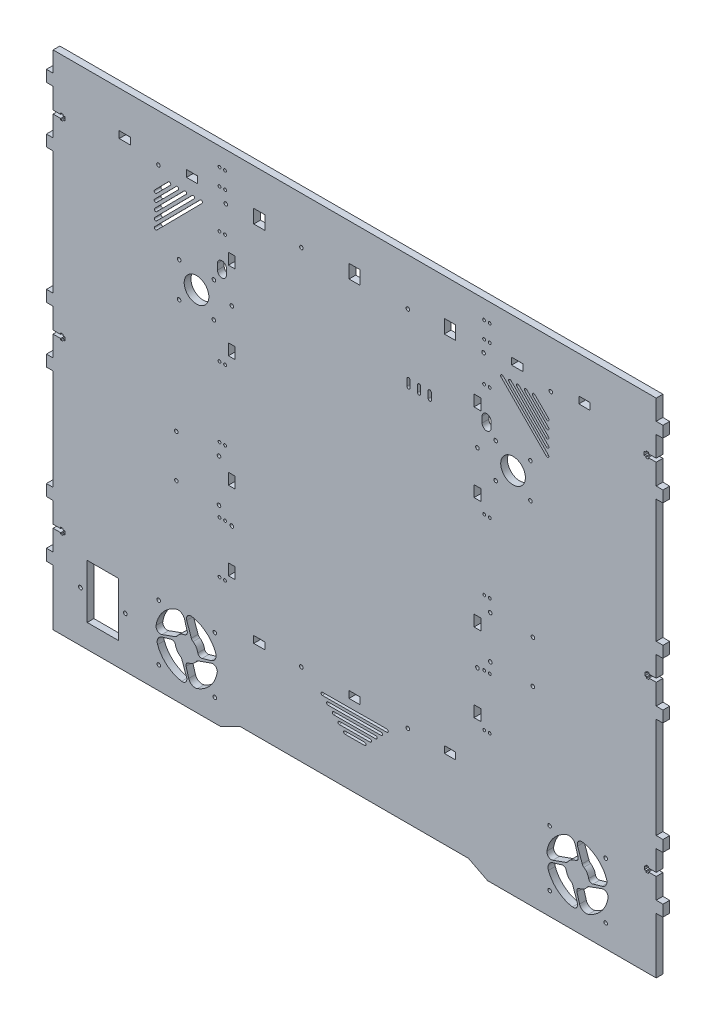
from build123d import *

# Parameters (mm, degrees)
SKETCH_1_R      = 1.6
SKETCH_1_R_2    = 1.65
SKETCH_1_R_3    = 1.25
SKETCH_1_R_4    = 11
SKETCH_1_W      = 10
SKETCH_1_H      = 12.1
SKETCH_1_H_2    = 6.1
SKETCH_1_W_2    = 28.000005
SKETCH_1_H_3    = 48
SKETCH_1_W_3    = 6.1
SKETCH_1_H_4    = 10
EXTRUDE_1_DEPTH = 6


with BuildPart() as part:
    # Эскиз1 → Бобышка-Вытянуть1 (new body)
    with BuildSketch(Plane.XY):
        Polygon((1048.755445299, 42.00723902), (1198.275289364, 42.00723902), (1215.275289364, 50.70723902), (1419.275289364, 50.70723902), (1436.275289364, 42.00723902), (1586.755445299, 42.00723902), (1586.755445299, 42.681206234), (1586.755445299, 91.90723902), (1592.755445299, 92.00723902), (1592.755445299, 102.00723902), (1586.755445299, 102.10723902), (1586.755445299, 120.45723902), (1579.955445299, 120.45723902), (1579.955445299, 119.25723902), (1577.755445299, 119.25723902), (1577.755445299, 120.45723902), (1576.255445299, 120.45723902), (1576.255445299, 123.55723902), (1577.755445299, 123.55723902), (1577.755445299, 124.75723902), (1579.955445299, 124.75723902), (1579.955445299, 123.55723902), (1586.755445299, 123.55723902), (1586.755445299, 141.90723902), (1592.755445299, 142.00723902), (1592.755445299, 152.00723902), (1586.755445299, 152.10723902), (1586.755445299, 241.90723902), (1592.755445299, 242.00723902), (1592.755445299, 252.00723902), (1586.755445299, 252.10723902), (1586.755445299, 270.45723902), (1580.435601234, 270.45723902), (1580.435601234, 269.25723902), (1578.235601234, 269.25723902), (1578.235601234, 270.45723902), (1576.735601234, 270.45723902), (1576.735601234, 273.55723902), (1578.235601234, 273.55723902), (1578.235601234, 274.75723902), (1580.435601234, 274.75723902), (1580.435601234, 273.55723902), (1586.755445299, 273.55723902), (1586.755445299, 291.90723902), (1592.755445298, 292.00723902), (1592.755445298, 302.00723902), (1586.755445298, 302.10723902), (1586.755445298, 411.90723902), (1592.755445297, 412.00723902), (1592.755445297, 422.00723902), (1586.755445299, 422.10723902), (1586.755445299, 440.461521146), (1586.498517724, 440.461521146), (1579.698517724, 440.461521146), (1579.698517724, 439.261521146), (1577.498517724, 439.261521146), (1577.498517724, 440.461521146), (1575.998517724, 440.461521146), (1575.998517724, 443.561521146), (1577.498517724, 443.561521146), (1577.498517724, 444.761521146), (1579.698517724, 444.761521146), (1579.698517724, 443.561521146), (1586.498517724, 443.561521146), (1586.755445299, 443.561521146), (1586.755445299, 461.915803272), (1592.755445296, 462.015803272), (1592.755445296, 472.00723902), (1586.755445299, 472.10723902), (1586.755445299, 490.00723902), (1586.01836179, 490.00723902), (1048.755445299, 490.00723902), (1048.755445299, 477.00723902), (1048.755445299, 472.10723902), (1042.755445299, 472.00723902), (1042.755445299, 462.00723902), (1048.755445299, 461.90723902), (1048.755445299, 443.55723902), (1055.555445299, 443.55723902), (1055.555445299, 444.75723902), (1057.755445299, 444.75723902), (1057.755445299, 443.55723902), (1059.255445299, 443.55723902), (1059.255445299, 440.45723902), (1057.755445299, 440.45723902), (1057.755445299, 439.25723902), (1055.555445299, 439.25723902), (1055.555445299, 440.45723902), (1048.755445299, 440.45723902), (1048.755445299, 422.10723902), (1042.755445299, 422.00723902), (1042.755445299, 412.00723902), (1048.755445299, 411.90723902), (1048.755445299, 302.10723902), (1042.755445299, 302.00723902), (1042.755445299, 292.00723902), (1048.755445299, 291.90723902), (1048.755445299, 273.55723902), (1055.555445299, 273.55723902), (1055.555445299, 274.75723902), (1057.755445299, 274.75723902), (1057.755445299, 273.55723902), (1059.255445299, 273.55723902), (1059.255445299, 270.45723902), (1057.755445299, 270.45723902), (1057.755445299, 269.25723902), (1055.555445299, 269.25723902), (1055.555445299, 270.45723902), (1048.755445299, 270.45723902), (1048.755445299, 252.10723902), (1042.755445299, 252.00723902), (1042.755445299, 242.00723902), (1048.755445299, 241.90723902), (1048.755445299, 152.10723902), (1042.755445299, 152.00723902), (1042.755445299, 142.00723902), (1048.755445299, 141.90723902), (1048.755445299, 123.55723902), (1055.555445299, 123.55723902), (1055.555445299, 124.75723902), (1057.755445299, 124.75723902), (1057.755445299, 123.55723902), (1059.255445299, 123.55723902), (1059.255445299, 120.45723902), (1057.755445299, 120.45723902), (1057.755445299, 119.25723902), (1055.555445299, 119.25723902), (1055.555445299, 120.45723902), (1048.755445299, 120.45723902), (1048.755445299, 102.10723902), (1042.755445299, 102.00723902), (1042.755445299, 92.00723902), (1048.755445299, 91.90723902), (1048.755445299, 42.676924107), align=None)
        with Locations((1202.755445299, 448.05723902)):
            Circle(SKETCH_1_R, mode=Mode.SUBTRACT)
        with Locations((1432.755445299, 448.05723902)):
            Circle(SKETCH_1_R, mode=Mode.SUBTRACT)
        with Locations((1365.255445299, 448.05723902)):
            Circle(SKETCH_1_R, mode=Mode.SUBTRACT)
        with Locations((1270.255445299, 448.05723902)):
            Circle(SKETCH_1_R, mode=Mode.SUBTRACT)
        with Locations((1365.255445299, 124.05491402)):
            Circle(SKETCH_1_R, mode=Mode.SUBTRACT)
        with Locations((1270.255445299, 124.05491402)):
            Circle(SKETCH_1_R, mode=Mode.SUBTRACT)
        with Locations((1492.755445299, 448.05723902)):
            Circle(SKETCH_1_R, mode=Mode.SUBTRACT)
        with Locations((1142.755445299, 448.05723902)):
            Circle(SKETCH_1_R, mode=Mode.SUBTRACT)
        with Locations((1073.162844871, 86.87758802)):
            Circle(SKETCH_1_R_2, mode=Mode.SUBTRACT)
        with Locations((1113.162844871, 86.87758802)):
            Circle(SKETCH_1_R_2, mode=Mode.SUBTRACT)
        with Locations((1143.031783229, 112.012971893)):
            Circle(SKETCH_1_R, mode=Mode.SUBTRACT)
        with Locations((1143.031783229, 62.012971893)):
            Circle(SKETCH_1_R, mode=Mode.SUBTRACT)
        with Locations((1541.689341871, 112.012971893)):
            Circle(SKETCH_1_R, mode=Mode.SUBTRACT)
        with Locations((1541.689341871, 62.012971893)):
            Circle(SKETCH_1_R, mode=Mode.SUBTRACT)
        with Locations((1491.689341871, 112.012971893)):
            Circle(SKETCH_1_R, mode=Mode.SUBTRACT)
        with Locations((1491.689341871, 62.012971893)):
            Circle(SKETCH_1_R, mode=Mode.SUBTRACT)
        with Locations((1193.031783229, 62.012971893)):
            Circle(SKETCH_1_R, mode=Mode.SUBTRACT)
        with Locations((1193.031783229, 112.012971893)):
            Circle(SKETCH_1_R, mode=Mode.SUBTRACT)
        with Locations((1427.305445299, 371.90723902)):
            Circle(SKETCH_1_R, mode=Mode.SUBTRACT)
        with Locations((1427.305445299, 201.90723902)):
            Circle(SKETCH_1_R, mode=Mode.SUBTRACT)
        with Locations((1208.205445299, 201.90723902)):
            Circle(SKETCH_1_R, mode=Mode.SUBTRACT)
        with Locations((1208.205445299, 371.90723902)):
            Circle(SKETCH_1_R, mode=Mode.SUBTRACT)
        with Locations((1202.195892293, 261.19163302)):
            Circle(SKETCH_1_R_3, mode=Mode.SUBTRACT)
        with Locations((1197.224537293, 261.25949102)):
            Circle(SKETCH_1_R_3, mode=Mode.SUBTRACT)
        with Locations((1196.754056699, 250.273882543)):
            Circle(SKETCH_1_R, mode=Mode.SUBTRACT)
        with Locations((1158.754056699, 250.273882543)):
            Circle(SKETCH_1_R, mode=Mode.SUBTRACT)
        with Locations((1158.754056699, 212.273882543)):
            Circle(SKETCH_1_R, mode=Mode.SUBTRACT)
        with Locations((1196.754056699, 212.273882543)):
            Circle(SKETCH_1_R, mode=Mode.SUBTRACT)
        with Locations((1202.160373293, 202.97489902)):
            Circle(SKETCH_1_R_3, mode=Mode.SUBTRACT)
        with Locations((1197.189018293, 203.04275802)):
            Circle(SKETCH_1_R_3, mode=Mode.SUBTRACT)
        with Locations((1202.158586293, 156.83802302)):
            Circle(SKETCH_1_R_3, mode=Mode.SUBTRACT)
        with Locations((1197.187231293, 156.90588202)):
            Circle(SKETCH_1_R_3, mode=Mode.SUBTRACT)
        with Locations((1438.308804299, 156.77016502)):
            Circle(SKETCH_1_R_3, mode=Mode.SUBTRACT)
        with Locations((1433.337449299, 156.83802402)):
            Circle(SKETCH_1_R_3, mode=Mode.SUBTRACT)
        with Locations((1433.339236299, 202.97490002)):
            Circle(SKETCH_1_R_3, mode=Mode.SUBTRACT)
        with Locations((1438.755445299, 212.273882543)):
            Circle(SKETCH_1_R, mode=Mode.SUBTRACT)
        with Locations((1438.310591299, 202.90704102)):
            Circle(SKETCH_1_R_3, mode=Mode.SUBTRACT)
        with Locations((1476.755445299, 212.273882543)):
            Circle(SKETCH_1_R, mode=Mode.SUBTRACT)
        with Locations((1476.755445299, 250.273882543)):
            Circle(SKETCH_1_R, mode=Mode.SUBTRACT)
        with Locations((1438.755445299, 250.273882543)):
            Circle(SKETCH_1_R, mode=Mode.SUBTRACT)
        with Locations((1438.346110299, 261.12377502)):
            Circle(SKETCH_1_R_3, mode=Mode.SUBTRACT)
        with Locations((1433.374755299, 261.19163302)):
            Circle(SKETCH_1_R_3, mode=Mode.SUBTRACT)
        with Locations((1438.326800299, 323.41350502)):
            Circle(SKETCH_1_R_3, mode=Mode.SUBTRACT)
        with Locations((1433.355445299, 323.48136302)):
            Circle(SKETCH_1_R_3, mode=Mode.SUBTRACT)
        with Locations((1443.569940463, 354.63990702)):
            Circle(SKETCH_1_R, mode=Mode.SUBTRACT)
        with Locations((1474.569940463, 354.63990702)):
            Circle(SKETCH_1_R, mode=Mode.SUBTRACT)
        with Locations((1474.569940463, 385.63990702)):
            Circle(SKETCH_1_R, mode=Mode.SUBTRACT)
        with Locations((1443.569940463, 385.63990702)):
            Circle(SKETCH_1_R, mode=Mode.SUBTRACT)
        with Locations((1438.192072034, 423.931096255)):
            Circle(SKETCH_1_R_3, mode=Mode.SUBTRACT)
        with Locations((1433.220717034, 423.998954255)):
            Circle(SKETCH_1_R_3, mode=Mode.SUBTRACT)
        with Locations((1438.208280034, 473.505890092)):
            Circle(SKETCH_1_R_3, mode=Mode.SUBTRACT)
        with Locations((1433.236925034, 473.573748092)):
            Circle(SKETCH_1_R_3, mode=Mode.SUBTRACT)
        with Locations((1438.227591034, 458.60640702)):
            Circle(SKETCH_1_R_3, mode=Mode.SUBTRACT)
        with Locations((1433.256236034, 458.67426502)):
            Circle(SKETCH_1_R_3, mode=Mode.SUBTRACT)
        with Locations((1202.176582293, 323.48136302)):
            Circle(SKETCH_1_R_3, mode=Mode.SUBTRACT)
        with Locations((1197.205227293, 323.54922102)):
            Circle(SKETCH_1_R_3, mode=Mode.SUBTRACT)
        with Locations((1161.210430299, 384.13990702)):
            Circle(SKETCH_1_R, mode=Mode.SUBTRACT)
        with Locations((1161.210430299, 353.13990702)):
            Circle(SKETCH_1_R, mode=Mode.SUBTRACT)
        with Locations((1176.710430299, 368.63990702)):
            Circle(SKETCH_1_R_4, mode=Mode.SUBTRACT)
        with Locations((1192.210430299, 353.13990702)):
            Circle(SKETCH_1_R, mode=Mode.SUBTRACT)
        with Locations((1192.210430299, 384.13990702)):
            Circle(SKETCH_1_R, mode=Mode.SUBTRACT)
        with Locations((1197.167882299, 424.066812255)):
            Circle(SKETCH_1_R_3, mode=Mode.SUBTRACT)
        with Locations((1202.139237299, 423.998954255)):
            Circle(SKETCH_1_R_3, mode=Mode.SUBTRACT)
        with Locations((1202.174756299, 458.67426502)):
            Circle(SKETCH_1_R_3, mode=Mode.SUBTRACT)
        with Locations((1197.203401299, 458.74212302)):
            Circle(SKETCH_1_R_3, mode=Mode.SUBTRACT)
        with Locations((1202.155445299, 473.573748092)):
            Circle(SKETCH_1_R_3, mode=Mode.SUBTRACT)
        with Locations((1197.184090299, 473.641606092)):
            Circle(SKETCH_1_R_3, mode=Mode.SUBTRACT)
        with Locations((1459.069940463, 370.13990702)):
            Circle(SKETCH_1_R_4, mode=Mode.SUBTRACT)
        with Locations((1402.755445299, 451.05723902)):
            Rectangle(SKETCH_1_W, SKETCH_1_H, mode=Mode.SUBTRACT)
        with Locations((1232.755445299, 451.05723902)):
            Rectangle(SKETCH_1_W, SKETCH_1_H, mode=Mode.SUBTRACT)
        with Locations((1317.755445299, 451.05723902)):
            Rectangle(SKETCH_1_W, SKETCH_1_H, mode=Mode.SUBTRACT)
        with Locations((1172.755445299, 454.05723902)):
            Rectangle(SKETCH_1_W, SKETCH_1_H_2, mode=Mode.SUBTRACT)
        with Locations((1462.755445299, 454.05723902)):
            Rectangle(SKETCH_1_W, SKETCH_1_H_2, mode=Mode.SUBTRACT)
        with Locations((1402.755445299, 124.05491402)):
            Rectangle(SKETCH_1_W, SKETCH_1_H_2, mode=Mode.SUBTRACT)
        with Locations((1317.755445299, 124.05491402)):
            Rectangle(SKETCH_1_W, SKETCH_1_H_2, mode=Mode.SUBTRACT)
        with Locations((1232.755445299, 124.05491402)):
            Rectangle(SKETCH_1_W, SKETCH_1_H_2, mode=Mode.SUBTRACT)
        with Locations((1093.162846371, 86.87758802)):
            Rectangle(SKETCH_1_W_2, SKETCH_1_H_3, mode=Mode.SUBTRACT)
        with BuildLine():
            Line((1455.450001299, 437.03084302), (1488.851497299, 403.25822002))
            ThreePointArc((1488.851497299, 403.25822002), (1490.619237301, 403.248453504), (1490.629003817, 405.016193507))
            Line((1490.629003817, 405.016193507), (1457.22750805, 438.788816271))
            ThreePointArc((1457.22750805, 438.788816271), (1455.459768173, 438.798582895), (1455.450001299, 437.03084302))
        make_face(mode=Mode.SUBTRACT)
        with BuildLine():
            Line((1326.629180083, 91.617684324), (1309.129447611, 91.521000907))
            ThreePointArc((1309.129447611, 91.521000907), (1307.872560358, 92.764075536), (1309.115634987, 94.020962789))
            Line((1309.115634987, 94.020962789), (1326.615368167, 94.1176455))
            ThreePointArc((1326.615368167, 94.1176455), (1327.872254713, 92.87457087), (1326.629180083, 91.617684324))
        make_face(mode=Mode.SUBTRACT)
        with BuildLine():
            Line((1331.601480015, 96.645231923), (1304.101899305, 96.493300132))
            ThreePointArc((1304.101899305, 96.493300132), (1302.845012759, 97.736375468), (1304.088088096, 98.993262014))
            Line((1304.088088096, 98.993262014), (1331.587668099, 99.145193099))
            ThreePointArc((1331.587668099, 99.145193099), (1332.844554645, 97.902118469), (1331.601480015, 96.645231923))
        make_face(mode=Mode.SUBTRACT)
        with BuildLine():
            Line((1336.573779947, 101.672779522), (1299.074351706, 101.465600064))
            ThreePointArc((1299.074351706, 101.465600064), (1297.81746516, 102.7086754), (1299.060540497, 103.965561946))
            Line((1299.060540497, 103.965561946), (1336.559967324, 104.172741405))
            ThreePointArc((1336.559967324, 104.172741405), (1337.816854577, 102.929666775), (1336.573779947, 101.672779522))
        make_face(mode=Mode.SUBTRACT)
        with BuildLine():
            Line((1289.005445299, 113.91016181), (1346.504567188, 114.227836603))
            ThreePointArc((1346.504567188, 114.227836603), (1347.761454441, 112.984761973), (1346.518379811, 111.72787472))
            Line((1346.518379811, 111.72787472), (1289.019256508, 111.410199928))
            ThreePointArc((1289.019256508, 111.410199928), (1287.762369962, 112.653275264), (1289.005445299, 113.91016181))
        make_face(mode=Mode.SUBTRACT)
        with BuildLine():
            Line((1341.546079879, 106.700327121), (1294.046804107, 106.437899996))
            ThreePointArc((1294.046804107, 106.437899996), (1292.789917561, 107.680975332), (1294.032992898, 108.937861878))
            Line((1294.032992898, 108.937861878), (1341.532267256, 109.200289004))
            ThreePointArc((1341.532267256, 109.200289004), (1342.789154509, 107.957214374), (1341.546079879, 106.700327121))
        make_face(mode=Mode.SUBTRACT)
        with BuildLine():
            Line((1448.379042299, 437.06990902), (1488.812431299, 396.18726002))
            ThreePointArc((1488.812431299, 396.18726002), (1490.580171301, 396.177493483), (1490.589937838, 397.945233486))
            Line((1490.589937838, 397.945233486), (1450.156548558, 438.827882757))
            ThreePointArc((1450.156548558, 438.827882757), (1448.38880843, 438.837649149), (1448.379042299, 437.06990902))
        make_face(mode=Mode.SUBTRACT)
        with BuildLine():
            Line((1469.591921299, 436.95271102), (1488.929629299, 417.40013902))
            ThreePointArc((1488.929629299, 417.40013902), (1490.697369798, 417.390372517), (1490.707136301, 419.158113017))
            Line((1490.707136301, 419.158113017), (1471.36942805, 438.710684271))
            ThreePointArc((1471.36942805, 438.710684271), (1469.601688173, 438.720450895), (1469.591921299, 436.95271102))
        make_face(mode=Mode.SUBTRACT)
        with BuildLine():
            Line((1476.662881299, 436.91364502), (1488.968695299, 424.47109902))
            ThreePointArc((1488.968695299, 424.47109902), (1490.736435798, 424.461332517), (1490.746202302, 426.229073017))
            Line((1490.746202302, 426.229073017), (1478.44038805, 438.671618271))
            ThreePointArc((1478.44038805, 438.671618271), (1476.672648173, 438.681384895), (1476.662881299, 436.91364502))
        make_face(mode=Mode.SUBTRACT)
        with BuildLine():
            Line((1462.520961299, 436.99177702), (1488.890563299, 410.32917902))
            ThreePointArc((1488.890563299, 410.32917902), (1490.658303798, 410.319412517), (1490.668070301, 412.087153017))
            Line((1490.668070301, 412.087153017), (1464.29846805, 438.749750271))
            ThreePointArc((1464.29846805, 438.749750271), (1462.530728173, 438.759516895), (1462.520961299, 436.99177702))
        make_face(mode=Mode.SUBTRACT)
        with BuildLine():
            Line((1530.317428095, 86.376861737), (1538.475232454, 88.733710728))
            ThreePointArc((1538.475232454, 88.733710728), (1542.17332586, 91.808427073), (1542.425449513, 96.611156411))
            ThreePointArc((1542.425449513, 96.611156411), (1534.073793622, 108.256420171), (1521.01322148, 114.154197673))
            ThreePointArc((1521.01322148, 114.154197673), (1517.29590567, 112.767766584), (1516.60124357, 108.861608297))
            Line((1516.60124357, 108.861608297), (1520.758003302, 97.218443933))
            ThreePointArc((1520.758003302, 97.218443933), (1521.358855676, 96.119028752), (1522.270346342, 95.259422982))
            ThreePointArc((1522.270346342, 95.259422982), (1525.056734388, 92.412613), (1526.534776336, 88.713467502))
            ThreePointArc((1526.534776336, 88.713467502), (1527.908153618, 86.706675217), (1530.317428095, 86.376861737))
        make_face(mode=Mode.SUBTRACT)
        with BuildLine():
            Line((1494.55707538, 86.909353323), (1506.20023984, 91.066114192))
            ThreePointArc((1506.20023984, 91.066114192), (1507.29965486, 91.666966573), (1508.159260507, 92.578457166))
            ThreePointArc((1508.159260507, 92.578457166), (1511.006070681, 95.364845404), (1514.70521647, 96.842887354))
            ThreePointArc((1514.70521647, 96.842887354), (1516.712008813, 98.216264561), (1517.041822384, 100.625539031))
            Line((1517.041822384, 100.625539031), (1514.684973929, 108.783342647))
            ThreePointArc((1514.684973929, 108.783342647), (1511.610257778, 112.481436135), (1506.807528513, 112.73356004))
            ThreePointArc((1506.807528513, 112.73356004), (1495.162263635, 104.381904059), (1489.264485679, 91.321331066))
            ThreePointArc((1489.264485679, 91.321331066), (1490.650916926, 87.604015185), (1494.55707538, 86.909353323))
        make_face(mode=Mode.SUBTRACT)
        with BuildLine():
            Line((1502.766409655, 87.3542366), (1494.608606517, 84.997388283))
            ThreePointArc((1494.608606517, 84.997388283), (1490.910512973, 81.92267202), (1490.658389213, 77.119942632))
            ThreePointArc((1490.658389213, 77.119942632), (1499.010045139, 65.474678548), (1512.070617536, 59.576900922))
            ThreePointArc((1512.070617536, 59.576900922), (1515.787933469, 60.963332183), (1516.482595285, 64.869490698))
            Line((1516.482595285, 64.869490698), (1512.325834508, 76.512654108))
            ThreePointArc((1512.325834508, 76.512654108), (1511.724982125, 77.612069087), (1510.813491551, 78.471674702))
            ThreePointArc((1510.813491551, 78.471674702), (1508.027103292, 81.318484881), (1506.549061331, 85.017630686))
            ThreePointArc((1506.549061331, 85.017630686), (1505.175684124, 87.024423029), (1502.766409655, 87.3542366))
        make_face(mode=Mode.SUBTRACT)
        with BuildLine():
            Line((1538.537978168, 86.806225385), (1526.894813708, 82.649464517))
            ThreePointArc((1526.894813708, 82.649464517), (1525.795398688, 82.048612136), (1524.935793041, 81.137121543))
            ThreePointArc((1524.935793041, 81.137121543), (1522.088983162, 78.350733496), (1518.389837768, 76.872691482))
            ThreePointArc((1518.389837768, 76.872691482), (1516.383045574, 75.499314225), (1516.053232058, 73.090039843))
            Line((1516.053232058, 73.090039843), (1518.410080468, 64.932236381))
            ThreePointArc((1518.410080468, 64.932236381), (1521.484796731, 61.234142837), (1526.287526119, 60.982019077))
            ThreePointArc((1526.287526119, 60.982019077), (1537.932790281, 69.333675098), (1543.830567869, 82.394247642))
            ThreePointArc((1543.830567869, 82.394247642), (1542.444136622, 86.111563523), (1538.537978168, 86.806225385))
        make_face(mode=Mode.SUBTRACT)
        with BuildLine():
            Line((1181.657669299, 437.90607702), (1141.224280061, 397.023427779))
            ThreePointArc((1141.224280061, 397.023427779), (1139.456540178, 397.013661139), (1139.446773299, 398.78140102))
            Line((1139.446773299, 398.78140102), (1179.8801633, 439.664050021))
            ThreePointArc((1179.8801633, 439.664050021), (1181.6479028, 439.67381652), (1181.657669299, 437.90607702))
        make_face(mode=Mode.SUBTRACT)
        with BuildLine():
            Line((1139.290509299, 427.06524102), (1151.5963233, 439.507786021))
            ThreePointArc((1151.5963233, 439.507786021), (1153.3640628, 439.51755252), (1153.373829299, 437.74981302))
            Line((1153.373829299, 437.74981302), (1141.068015583, 425.307267307))
            ThreePointArc((1141.068015583, 425.307267307), (1139.300275442, 425.297500878), (1139.290509299, 427.06524102))
        make_face(mode=Mode.SUBTRACT)
        with BuildLine():
            Line((1174.586709299, 437.86701102), (1141.185214326, 404.094387048))
            ThreePointArc((1141.185214326, 404.094387048), (1139.417473812, 404.084620506), (1139.407707299, 405.85236102))
            Line((1139.407707299, 405.85236102), (1172.8092033, 439.624984021))
            ThreePointArc((1172.8092033, 439.624984021), (1174.5769428, 439.63475052), (1174.586709299, 437.86701102))
        make_face(mode=Mode.SUBTRACT)
        with BuildLine():
            Line((1139.329575299, 419.99428102), (1158.6672833, 439.546852021))
            ThreePointArc((1158.6672833, 439.546852021), (1160.4350228, 439.55661852), (1160.444789299, 437.78887902))
            Line((1160.444789299, 437.78887902), (1141.10708157, 418.236307294))
            ThreePointArc((1141.10708157, 418.236307294), (1139.339341436, 418.226540884), (1139.329575299, 419.99428102))
        make_face(mode=Mode.SUBTRACT)
        with BuildLine():
            Line((1167.515749299, 437.82794502), (1141.146147564, 411.165347288))
            ThreePointArc((1141.146147564, 411.165347288), (1139.378407433, 411.155580887), (1139.368641299, 412.92332102))
            Line((1139.368641299, 412.92332102), (1165.7382433, 439.585918021))
            ThreePointArc((1165.7382433, 439.585918021), (1167.5059828, 439.59568452), (1167.515749299, 437.82794502))
        make_face(mode=Mode.SUBTRACT)
        with Locations((1522.755445299, 454.05723902)):
            Rectangle(SKETCH_1_W, SKETCH_1_H_2, mode=Mode.SUBTRACT)
        with Locations((1112.755445299, 454.05723902)):
            Rectangle(SKETCH_1_W, SKETCH_1_H_2, mode=Mode.SUBTRACT)
        with BuildLine():
            Line((1167.825036644, 64.869490698), (1163.668275867, 76.512654108))
            ThreePointArc((1163.668275867, 76.512654108), (1163.067423484, 77.612069087), (1162.155932909, 78.471674702))
            ThreePointArc((1162.155932909, 78.471674702), (1159.36954465, 81.318484881), (1157.89150269, 85.017630686))
            ThreePointArc((1157.89150269, 85.017630686), (1156.518125483, 87.024423029), (1154.108851013, 87.3542366))
            Line((1154.108851013, 87.3542366), (1145.951047876, 84.997388283))
            ThreePointArc((1145.951047876, 84.997388283), (1142.252954332, 81.92267202), (1142.000830572, 77.119942632))
            ThreePointArc((1142.000830572, 77.119942632), (1150.352486498, 65.474678548), (1163.413058895, 59.576900922))
            ThreePointArc((1163.413058895, 59.576900922), (1167.130374827, 60.963332183), (1167.825036644, 64.869490698))
        make_face(mode=Mode.SUBTRACT)
        with Locations((1427.305445299, 406.90723902)):
            Rectangle(SKETCH_1_W_3, SKETCH_1_H_4, mode=Mode.SUBTRACT)
        with Locations((1427.305445299, 336.90723902)):
            Rectangle(SKETCH_1_W_3, SKETCH_1_H_4, mode=Mode.SUBTRACT)
        with Locations((1427.305445299, 236.90723902)):
            Rectangle(SKETCH_1_W_3, SKETCH_1_H_4, mode=Mode.SUBTRACT)
        with Locations((1427.305445299, 166.90723902)):
            Rectangle(SKETCH_1_W_3, SKETCH_1_H_4, mode=Mode.SUBTRACT)
        with Locations((1208.205445299, 166.90723902)):
            Rectangle(SKETCH_1_W_3, SKETCH_1_H_4, mode=Mode.SUBTRACT)
        with Locations((1208.205445299, 236.90723902)):
            Rectangle(SKETCH_1_W_3, SKETCH_1_H_4, mode=Mode.SUBTRACT)
        with Locations((1208.205445299, 336.90723902)):
            Rectangle(SKETCH_1_W_3, SKETCH_1_H_4, mode=Mode.SUBTRACT)
        with Locations((1208.205445299, 406.90723902)):
            Rectangle(SKETCH_1_W_3, SKETCH_1_H_4, mode=Mode.SUBTRACT)
        with BuildLine():
            Line((1145.899516738, 86.909353323), (1157.542681199, 91.066114192))
            ThreePointArc((1157.542681199, 91.066114192), (1158.642096219, 91.666966573), (1159.501701866, 92.578457166))
            ThreePointArc((1159.501701866, 92.578457166), (1162.348512039, 95.364845404), (1166.047657828, 96.842887354))
            ThreePointArc((1166.047657828, 96.842887354), (1168.054450172, 98.216264561), (1168.384263743, 100.625539031))
            Line((1168.384263743, 100.625539031), (1166.027415288, 108.783342647))
            ThreePointArc((1166.027415288, 108.783342647), (1162.952699137, 112.481436135), (1158.149969872, 112.73356004))
            ThreePointArc((1158.149969872, 112.73356004), (1146.504704993, 104.381904059), (1140.606927038, 91.321331066))
            ThreePointArc((1140.606927038, 91.321331066), (1141.993358285, 87.604015185), (1145.899516738, 86.909353323))
        make_face(mode=Mode.SUBTRACT)
        with BuildLine():
            Line((1189.880419527, 86.806225385), (1178.237255066, 82.649464517))
            ThreePointArc((1178.237255066, 82.649464517), (1177.137840046, 82.048612136), (1176.2782344, 81.137121543))
            ThreePointArc((1176.2782344, 81.137121543), (1173.43142452, 78.350733496), (1169.732279127, 76.872691482))
            ThreePointArc((1169.732279127, 76.872691482), (1167.725486933, 75.499314225), (1167.395673416, 73.090039843))
            Line((1167.395673416, 73.090039843), (1169.752521827, 64.932236381))
            ThreePointArc((1169.752521827, 64.932236381), (1172.82723809, 61.234142837), (1177.629967478, 60.982019077))
            ThreePointArc((1177.629967478, 60.982019077), (1189.275231639, 69.333675098), (1195.173009228, 82.394247642))
            ThreePointArc((1195.173009228, 82.394247642), (1193.78657798, 86.111563523), (1189.880419527, 86.806225385))
        make_face(mode=Mode.SUBTRACT)
        with BuildLine():
            Line((1181.659869454, 86.376861737), (1189.817673812, 88.733710728))
            ThreePointArc((1189.817673812, 88.733710728), (1193.515767218, 91.808427073), (1193.767890872, 96.611156411))
            ThreePointArc((1193.767890872, 96.611156411), (1185.416234981, 108.256420171), (1172.355662838, 114.154197673))
            ThreePointArc((1172.355662838, 114.154197673), (1168.638347028, 112.767766584), (1167.943684929, 108.861608297))
            Line((1167.943684929, 108.861608297), (1172.100444661, 97.218443933))
            ThreePointArc((1172.100444661, 97.218443933), (1172.701297034, 96.119028752), (1173.6127877, 95.259422982))
            ThreePointArc((1173.6127877, 95.259422982), (1176.399175747, 92.412613), (1177.877217694, 88.713467502))
            ThreePointArc((1177.877217694, 88.713467502), (1179.250594977, 86.706675217), (1181.659869454, 86.376861737))
        make_face(mode=Mode.SUBTRACT)
        with BuildLine():
            Line((1431.430200475, 398.348460396), (1431.430200475, 393.065519916))
            ThreePointArc((1431.430200475, 393.065519916), (1435.430200475, 389.065519916), (1439.430200475, 393.065519916))
            Line((1439.430200475, 393.065519916), (1439.430200475, 398.348460396))
            ThreePointArc((1439.430200475, 398.348460396), (1435.430200475, 402.348460396), (1431.430200475, 398.348460396))
        make_face(mode=Mode.SUBTRACT)
        with BuildLine():
            Line((1195.377365739, 398.416318396), (1195.377365739, 393.133377916))
            ThreePointArc((1195.377365739, 393.133377916), (1199.377365739, 389.133377916), (1203.377365739, 393.133377916))
            Line((1203.377365739, 393.133377916), (1203.377365739, 398.416318396))
            ThreePointArc((1203.377365739, 398.416318396), (1199.377365739, 402.416318396), (1195.377365739, 398.416318396))
        make_face(mode=Mode.SUBTRACT)
        with BuildLine():
            Line((1383.355445299, 394.00723902), (1383.355445299, 388.00723902))
            ThreePointArc((1383.355445299, 388.00723902), (1384.755445299, 386.60723902), (1386.155445299, 388.00723902))
            Line((1386.155445299, 388.00723902), (1386.155445299, 394.00723902))
            ThreePointArc((1386.155445299, 394.00723902), (1384.755445299, 395.40723902), (1383.355445299, 394.00723902))
        make_face(mode=Mode.SUBTRACT)
        with BuildLine():
            Line((1373.855445299, 394.00723902), (1373.855445299, 388.00723902))
            ThreePointArc((1373.855445299, 388.00723902), (1375.255445299, 386.60723902), (1376.655445299, 388.00723902))
            Line((1376.655445299, 388.00723902), (1376.655445299, 394.00723902))
            ThreePointArc((1376.655445299, 394.00723902), (1375.255445299, 395.40723902), (1373.855445299, 394.00723902))
        make_face(mode=Mode.SUBTRACT)
        with BuildLine():
            Line((1364.355445299, 394.00723902), (1364.355445299, 388.00723902))
            ThreePointArc((1364.355445299, 388.00723902), (1365.755445299, 386.60723902), (1367.155445299, 388.00723902))
            Line((1367.155445299, 388.00723902), (1367.155445299, 394.00723902))
            ThreePointArc((1367.155445299, 394.00723902), (1365.755445299, 395.40723902), (1364.355445299, 394.00723902))
        make_face(mode=Mode.SUBTRACT)
    extrude(amount=-EXTRUDE_1_DEPTH)


solid = part.part
